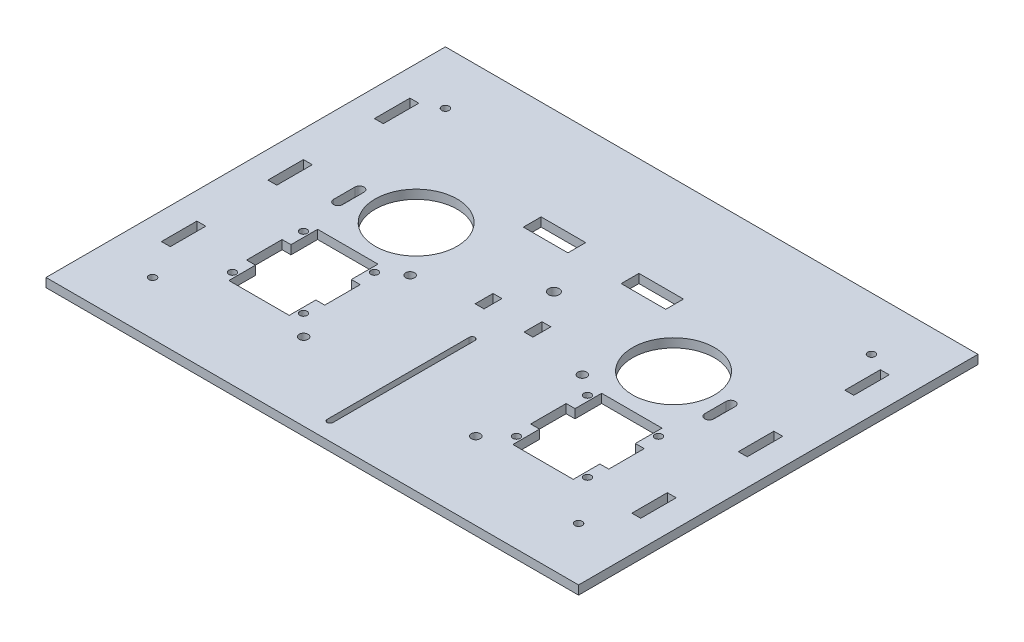
from build123d import *

# Parameters (mm, degrees)
SKETCH_1_R          = 2.1
SKETCH_1_W          = 5
SKETCH_1_H          = 20
EXTRUDE_1_DEPTH     = 5
SKETCH_3_R          = 2.5
SKETCH_3_R_2        = 23.1
SKETCH_3_R_3        = 3
SKETCH_3_R_4        = 2.05
SKETCH_3_W          = 5
SKETCH_3_H          = 10.1
CUT_EXTRUDE_1_DEPTH = 193.158788506
SKETCH_5_W          = 25.1
SKETCH_5_H          = 10
CUT_EXTRUDE_5_DEPTH = 193.158788506


with BuildPart() as part:
    # 草圖1 → 填料-伸長1 (new body)
    with BuildSketch(Plane(origin=(0, 0, 0), x_dir=(1, 0, 0), z_dir=(0, 1, 0))):
        Polygon((-150, 100), (-150, -100), (-150, -120), (150, -120), (150, -100), (150, 100), (150, 105), (-150, 105), align=None)
        with Locations((-120, 75)):
            Circle(SKETCH_1_R, mode=Mode.SUBTRACT)
        with Locations((120, 75)):
            Circle(SKETCH_1_R, mode=Mode.SUBTRACT)
        with Locations((120, -90)):
            Circle(SKETCH_1_R, mode=Mode.SUBTRACT)
        with Locations((-120, -90)):
            Circle(SKETCH_1_R, mode=Mode.SUBTRACT)
        with Locations((132.5, -60)):
            Rectangle(SKETCH_1_W, SKETCH_1_H, mode=Mode.SUBTRACT)
        with Locations((-132.5, 60)):
            Rectangle(SKETCH_1_W, SKETCH_1_H, mode=Mode.SUBTRACT)
        with Locations((-132.5, 0)):
            Rectangle(SKETCH_1_W, SKETCH_1_H, mode=Mode.SUBTRACT)
        with Locations((-132.5, -60)):
            Rectangle(SKETCH_1_W, SKETCH_1_H, mode=Mode.SUBTRACT)
        with Locations((132.5, 0)):
            Rectangle(SKETCH_1_W, SKETCH_1_H, mode=Mode.SUBTRACT)
        with Locations((132.5, 60)):
            Rectangle(SKETCH_1_W, SKETCH_1_H, mode=Mode.SUBTRACT)
    extrude(amount=EXTRUDE_1_DEPTH)

    # 草圖3 → 除料-伸長1 (cut, through all)
    with BuildSketch(Plane(origin=(0, 5, 0), x_dir=(1, 0, 0), z_dir=(0, 1, 0))):
        with Locations((-48.5, -16.386127875)):
            Circle(SKETCH_3_R)
        with Locations((48.5, -16.386127875)):
            Circle(SKETCH_3_R)
        with Locations((48.5, -76.386127875)):
            Circle(SKETCH_3_R)
        with Locations((-48.5, -76.386127875)):
            Circle(SKETCH_3_R)
        with Locations((-72.5, 11)):
            Circle(SKETCH_3_R_2)
        with Locations((72.5, 11)):
            Circle(SKETCH_3_R_2)
        with Locations((0, 16.113872125)):
            Circle(SKETCH_3_R_3)
        with Locations((-100, -65)):
            Circle(SKETCH_3_R_4)
        with Locations((-60, -65)):
            Circle(SKETCH_3_R_4)
        with Locations((-60, -25)):
            Circle(SKETCH_3_R_4)
        with Locations((-100, -25)):
            Circle(SKETCH_3_R_4)
        with Locations((100, -25)):
            Circle(SKETCH_3_R_4)
        with Locations((60, -25)):
            Circle(SKETCH_3_R_4)
        with Locations((60, -65)):
            Circle(SKETCH_3_R_4)
        with Locations((100, -65)):
            Circle(SKETCH_3_R_4)
        Polygon((-97, -70), (-63, -70), (-63, -55), (-58, -55), (-58, -35), (-63, -35), (-63, -20), (-97, -20), (-97, -35), (-102, -35), (-102, -55), (-97, -55), align=None)
        Polygon((97, -20), (97, -35), (102, -35), (102, -55), (97, -55), (97, -70), (63, -70), (63, -55), (58, -55), (58, -35), (63, -35), (63, -20), align=None)
        with Locations((-13.775, -6.936127875)):
            Rectangle(SKETCH_3_W, SKETCH_3_H)
        with Locations((13.775, -6.936127875)):
            Rectangle(SKETCH_3_W, SKETCH_3_H)
        with BuildLine():
            Line((1.6, -30), (1.6, -110))
            ThreePointArc((1.6, -110), (0, -111.6), (-1.6, -110))
            Line((-1.6, -110), (-1.6, -30))
            ThreePointArc((-1.6, -30), (0, -28.4), (1.6, -30))
        make_face()
    extrude(amount=-CUT_EXTRUDE_1_DEPTH, mode=Mode.SUBTRACT)

    # 草圖5 → 除料-伸長5 (cut, through all)
    with BuildSketch(Plane(origin=(0, 5, 0), x_dir=(1, 0, 0), z_dir=(0, 1, 0))):
        with Locations((27.55, 44)):
            Rectangle(SKETCH_5_W, SKETCH_5_H)
        with Locations((-27.55, 44)):
            Rectangle(SKETCH_5_W, SKETCH_5_H)
        with BuildLine():
            Line((-102, 11.15), (-102, -0.949999542))
            ThreePointArc((-102, -0.949999542), (-104.55, -3.5), (-107.1, -0.949999542))
            Line((-107.1, -0.949999542), (-107.1, 11.15))
            ThreePointArc((-107.1, 11.15), (-104.55, 13.7), (-102, 11.15))
        make_face()
        with BuildLine():
            Line((102, 11.15), (102, -0.949999542))
            ThreePointArc((102, -0.949999542), (104.55, -3.5), (107.1, -0.949999542))
            Line((107.1, -0.949999542), (107.1, 11.15))
            ThreePointArc((107.1, 11.15), (104.55, 13.7), (102, 11.15))
        make_face()
    extrude(amount=-CUT_EXTRUDE_5_DEPTH, mode=Mode.SUBTRACT)


solid = part.part
